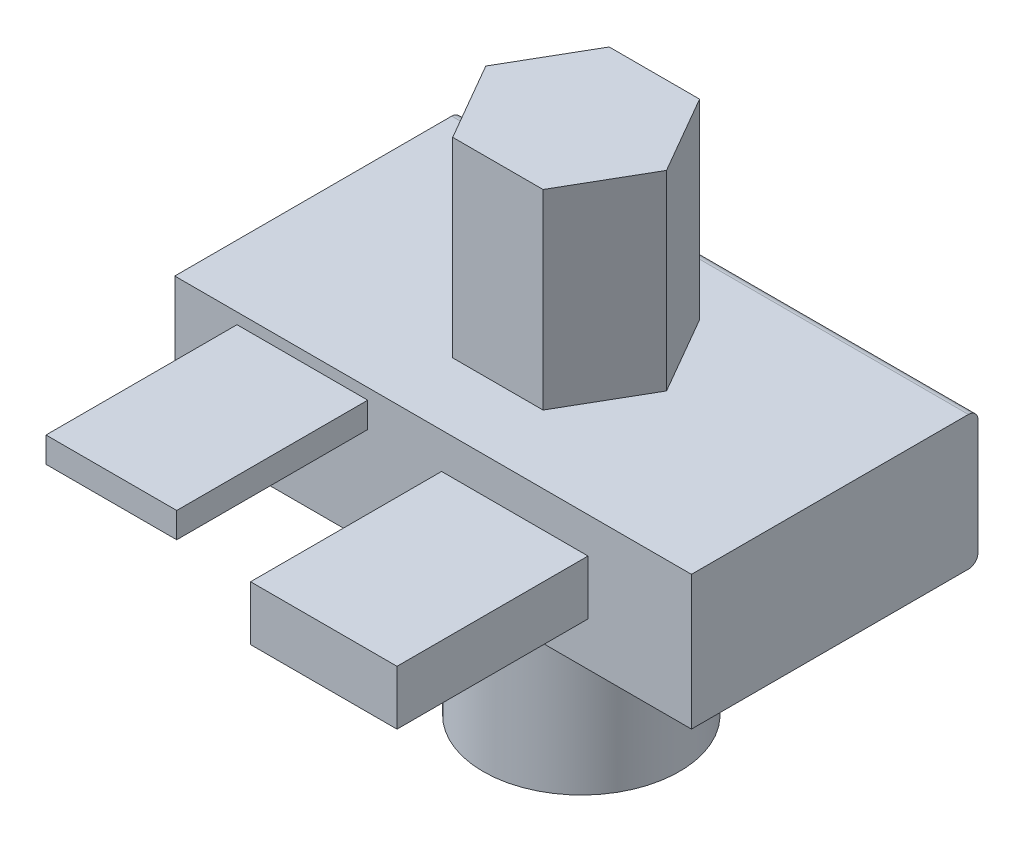
from build123d import *

# Parameters (mm, degrees)
SKETCH1_W           = 137.407001984
SKETCH1_H           = 35.641957088
BOSS_EXTRUDE1_DEPTH = 76.2
BOSS_EXTRUDE2_DEPTH = 50.8
SKETCH3_R           = 26.099786647
BOSS_EXTRUDE3_DEPTH = 50.8
SKETCH4_W           = 34.762618313
SKETCH4_H           = 6.759398006
SKETCH4_W_2         = 38.947007555
SKETCH4_H_2         = 14.484424297
BOSS_EXTRUDE4_DEPTH = 50.8
FILLET1_R           = 2.54
FILLET2_R           = 2.54


with BuildPart() as part:
    # Sketch1 → Boss-Extrude1 (new body)
    with BuildSketch(Plane.XY):
        Rectangle(SKETCH1_W, SKETCH1_H)
    extrude(amount=BOSS_EXTRUDE1_DEPTH)

    # Sketch2 → Boss-Extrude2 (add)
    with BuildSketch(Plane(origin=(0, 17.820978544, 0), x_dir=(1, 0, 0), z_dir=(0, 1, 0))):
        Polygon((23.159003861, -37.290679973), (11.143714224, -16.479587852), (-12.886865052, -16.479587852), (-24.90215469, -37.290679973), (-12.886865052, -58.101772093), (11.143714224, -58.101772093), align=None)
    extrude(amount=BOSS_EXTRUDE2_DEPTH)

    # Sketch3 → Boss-Extrude3 (add)
    with BuildSketch(Plane.XZ.offset(17.820978544)):
        with Locations((0, 36.792636879)):
            Circle(SKETCH3_R)
    extrude(amount=BOSS_EXTRUDE3_DEPTH)

    # Sketch4 → Boss-Extrude4 (add)
    with BuildSketch(Plane.XY.offset(76.2)):
        with Locations((-34.762618313, 11.507070414)):
            Rectangle(SKETCH4_W, SKETCH4_H)
        with Locations((21.726636446, 1.04609731)):
            Rectangle(SKETCH4_W_2, SKETCH4_H_2)
    extrude(amount=BOSS_EXTRUDE4_DEPTH)

    # Fillet1
    fillet1_edges = [part.edges().sort_by_distance(p)[0] for p in [
        (-26.099786647, -17.820978544, 36.792636879),
    ]]
    fillet(fillet1_edges, radius=FILLET1_R)

    # Fillet2
    fillet2_edges = [part.edges().sort_by_distance(p)[0] for p in [
        (0, -17.820978544, 0),
        (0, 17.820978544, 0),
    ]]
    fillet(fillet2_edges, radius=FILLET2_R)


solid = part.part
